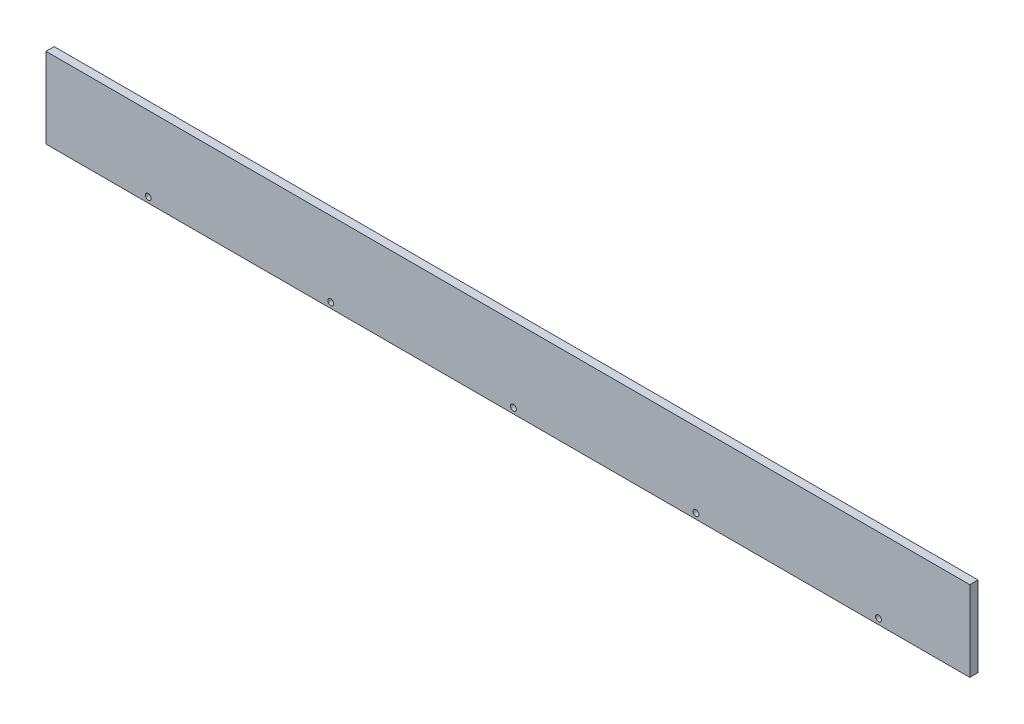
from build123d import *

# Parameters (mm, degrees)
SKETCH1_W           = 506
SKETCH1_H           = 44
SKETCH1_R           = 1.6
BOSS_EXTRUDE1_DEPTH = 4.5


with BuildPart() as part:
    # Sketch1 → Boss-Extrude1 (new body)
    with BuildSketch(Plane.XY):
        Rectangle(SKETCH1_W, SKETCH1_H)
        with Locations((203, -19)):
            Circle(SKETCH1_R, mode=Mode.SUBTRACT)
        with Locations((103, -19)):
            Circle(SKETCH1_R, mode=Mode.SUBTRACT)
        with Locations((3, -19)):
            Circle(SKETCH1_R, mode=Mode.SUBTRACT)
        with Locations((-97, -19)):
            Circle(SKETCH1_R, mode=Mode.SUBTRACT)
        with Locations((-197, -19)):
            Circle(SKETCH1_R, mode=Mode.SUBTRACT)
    extrude(amount=BOSS_EXTRUDE1_DEPTH)


solid = part.part
